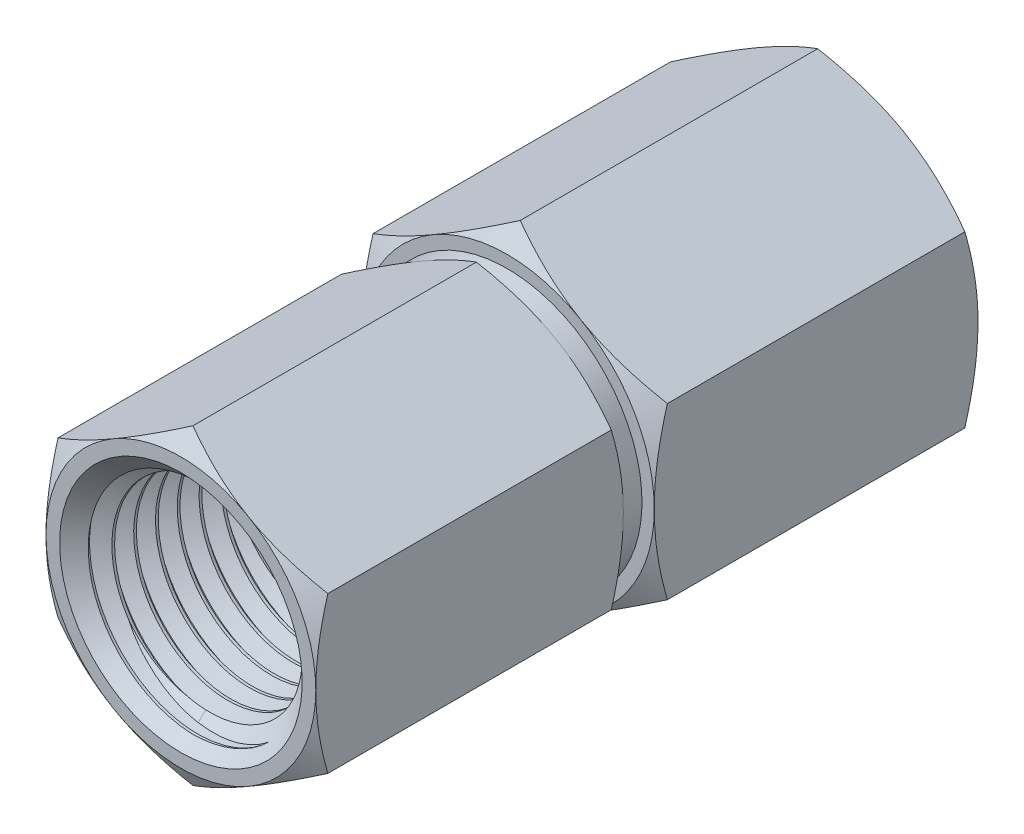
from build123d import *

# Parameters (mm, degrees)
SKETCH2_R           = 9.398
BOSS_EXTRUDE1_DEPTH = 20.955
SKETCH3_R           = 8.60425
BOSS_EXTRUDE2_DEPTH = 19.90725
SWEEP1_PITCH        = 1.411111111
SWEEP2_PITCH        = 1.411794907
SWEEP2_HEIGHT       = 11.616831111
SWEEP2_RADIUS       = 6.705527712
SWEEP2_START_ANGLE  = 90


with BuildPart() as part:
    # Sketch1 → Revolve1 (revolve)
    with BuildSketch(Plane(origin=(0, 0, 0), x_dir=(0, 0, -1), z_dir=(1, 0, 0)), mode=Mode.PRIVATE) as revolve1_sk:
        Polygon((-21.034375, 7.14375), (-21.034375, 8.73125), (0.079375, 8.73125), (0.079375, 9.525), (21.034375, 9.525), (21.034375, 6.705527712), (10.828655, 6.387771669), (10.828655, 3.81), (-8.255777195, 3.81), (-11.08075, 5.938769698), (-11.08075, 7.14375), align=None)
    revolve(revolve1_sk.sketch.rotate(Axis((0, 0, 21.034375), (0, 0, -1)), 180), axis=Axis((0, 0, 21.034375), (0, 0, -1)))

    # Sketch2 → Boss-Extrude1 (add)
    with BuildSketch(Plane(origin=(0, 0, -21.034375), x_dir=(-1, 0, 0), z_dir=(0, 0, -1))):
        Polygon((0, 10.998522628), (-9.525, 5.499261314), (-9.525, -5.499261314), (0, -10.998522628), (9.525, -5.499261314), (9.525, 5.499261314), align=None)
        Circle(SKETCH2_R, mode=Mode.SUBTRACT)
    extrude(amount=-BOSS_EXTRUDE1_DEPTH)

    # Sketch3 → Boss-Extrude2 (add)
    with BuildSketch(Plane.XY.offset(21.034375)):
        Polygon((0, 10.081979076), (-8.73125, 5.040989538), (-8.73125, -5.040989538), (0, -10.081979076), (8.73125, -5.040989538), (8.73125, 5.040989538), align=None)
        Circle(SKETCH3_R, mode=Mode.SUBTRACT)
    extrude(amount=-BOSS_EXTRUDE2_DEPTH)

    # Sketch4 → Cut-Revolve1 (revolve, cut)
    with BuildSketch(Plane(origin=(0, 0, 0), x_dir=(0, 0, -1), z_dir=(1, 0, 0))):
        Polygon((-21.034375, 8.73125), (-21.034375, 10.081979076), (-20.254531205, 10.081979076), align=None)
        Polygon((0.079375, 9.525), (0.079375, 10.998522628), (0.930113686, 10.998522628), align=None)
        Polygon((20.183636314, 10.998522628), (21.034375, 9.525), (21.034375, 10.998522628), align=None)
        Polygon((-1.906968795, 10.081979076), (-1.127125, 8.73125), (-1.127125, 10.081979076), align=None)
    revolve(axis=Axis((0, 0, 21.034375), (0, 0, -1)), mode=Mode.SUBTRACT)

    # Sweep1: the profile of Sketch7 screwed along a right-hand helix of 8.05375 turns, 8 arcs to a turn; built about Z, then put on its axis
    sweep1_z = Axis((0, 0, 0), (0, 0, 1))
    sweep1_corners = [(7.27075, 0, -1.308045706), (6.227206448, 0, -0.705555556), (6.227206448, 0, -0.529166667), (7.27075, 0, 0.073323484)]
    with BuildLine(mode=Mode.PRIVATE) as sweep1_profile:
        Line(sweep1_corners[0], sweep1_corners[1])
        Line(sweep1_corners[1], sweep1_corners[2])
        Line(sweep1_corners[2], sweep1_corners[3])
        Line(sweep1_corners[3], sweep1_corners[0])
    sweep1_cap = Face(sweep1_profile.wire())
    sweep1_turn_angles = [0, 22.5, 45, 67.5, 90, 112.5, 135, 157.5, 180, 202.5, 225, 247.5, 270, 292.5, 315, 337.5, 360]
    sweep1_turn_weights = [1, 0.9238795325112867, 1, 0.9238795325112867, 1, 0.9238795325112867, 1, 0.9238795325112867, 1, 0.9238795325112867, 1, 0.9238795325112867, 1, 0.9238795325112867, 1, 0.9238795325112867, 1]
    sweep1_turn_rails = [Edge.make_bspline([Vector(p[0], p[1], 0).rotate(sweep1_z, sweep1_turn_angles[k]) / sweep1_turn_weights[k] + Vector(0, 0, p[2] + SWEEP1_PITCH * sweep1_turn_angles[k] / 360) for k in range(17)], [0, 0, 0, 1, 1, 2, 2, 3, 3, 4, 4, 5, 5, 6, 6, 7, 7, 8, 8, 8], 2, sweep1_turn_weights) for p in sweep1_corners]
    sweep1_turn_sides = [Face.make_surface_from_curves(sweep1_turn_rails[p[0]], sweep1_turn_rails[p[1]]) for p in [(0, 1), (1, 2), (2, 3), (3, 0)]]
    sweep1_last_angles = [2880, 2889.675, 2899.35]
    sweep1_last_weights = [1, 0.9857768926152028, 1]
    sweep1_last_rails = [Edge.make_bspline([Vector(p[0], p[1], 0).rotate(sweep1_z, sweep1_last_angles[k]) / sweep1_last_weights[k] + Vector(0, 0, p[2] + SWEEP1_PITCH * sweep1_last_angles[k] / 360) for k in range(3)], [0, 0, 0, 1, 1, 1], 2, sweep1_last_weights) for p in sweep1_corners]
    sweep1_last_sides = [Face.make_surface_from_curves(sweep1_last_rails[p[0]], sweep1_last_rails[p[1]]) for p in [(0, 1), (1, 2), (2, 3), (3, 0)]]
    sweep1 = Plane(origin=(0, 0, 21.034375), x_dir=(0, 1, 0), z_dir=(0, 0, -1)) * Solid(Shell([*[p.moved(Location((0, 0, SWEEP1_PITCH * i))) for i in range(8) for p in sweep1_turn_sides], *sweep1_last_sides, sweep1_cap, sweep1_cap.rotate(sweep1_z, 2899.35).moved(Location((0, 0, SWEEP1_PITCH * 2899.35 / 360)))]))
    add(sweep1)

    # Sweep2: sweep along a helix
    with BuildLine() as sweep2_path:
        # a taper helix: rise per turn along the axis 1.411111111, along the cone's slant (build123d's pitch) 1.411794907
        add(Helix(SWEEP2_PITCH, SWEEP2_HEIGHT, SWEEP2_RADIUS, center=(0, 0, -21.034375), direction=(0, 0, 1), cone_angle=-1.783333333, mode=Mode.PRIVATE).rotate(Axis((0, 0, -21.034375), (0, 0, 1)), SWEEP2_START_ANGLE))
    # Sketch9 → Sweep2 (sweep)
    with BuildSketch(Plane(origin=(0, 0, 0), x_dir=(0, 0, -1), z_dir=(1, 0, 0))):
        Polygon((20.961051516, 6.832527712), (21.563541667, 5.78898416), (21.739930556, 5.78898416), (22.342420706, 6.832527712), align=None)
    sweep(path=sweep2_path.line, is_frenet=True)

    # Sketch10 → Cut-Revolve2 (revolve, cut)
    with BuildSketch(Plane(origin=(0, 0, 0), x_dir=(0, 0, -1), z_dir=(1, 0, 0)), mode=Mode.PRIVATE) as cut_revolve2_sk:
        Polygon((-21.034375, 7.849305556), (-13.185069444, 0), (-28.883680556, 0), (-28.883680556, 7.849305556), align=None)
        Polygon((21.034375, 7.411083268), (13.623291732, 0), (28.445458268, 0), (28.445458268, 7.411083268), align=None)
    revolve(cut_revolve2_sk.sketch.rotate(Axis((0, 0, 13.185069444), (0, 0, 1)), 180), axis=Axis((0, 0, 13.185069444), (0, 0, 1)), mode=Mode.SUBTRACT)


solid = part.part
